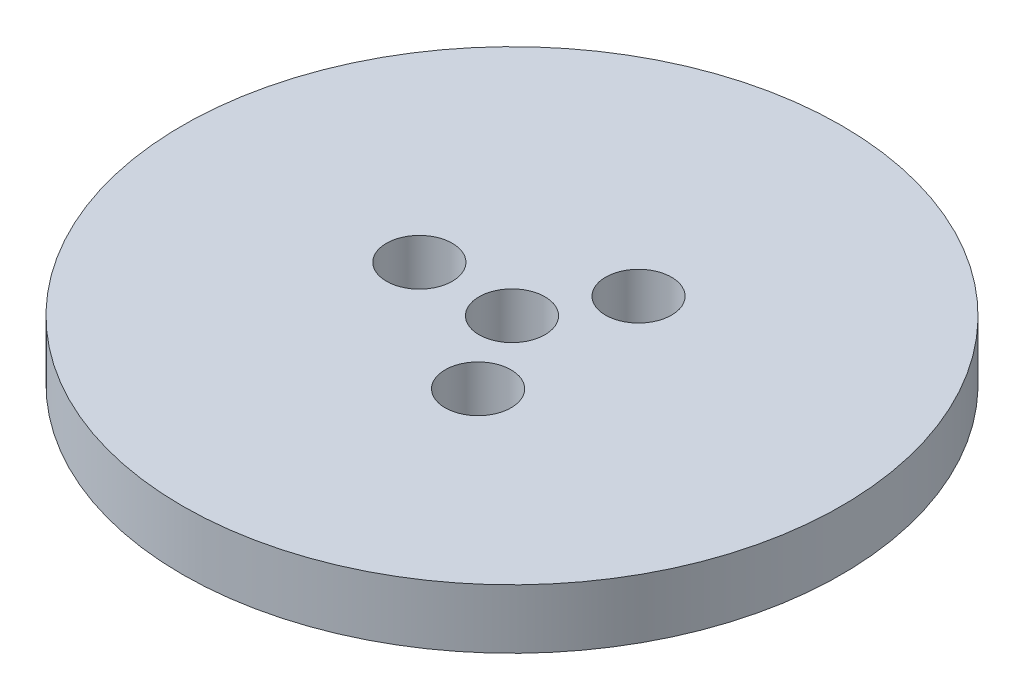
from build123d import *

# Parameters (mm, degrees)
SKETCH1_R           = 100
BOSS_EXTRUDE1_DEPTH = 18
SKETCH2_R           = 10
CUT_EXTRUDE1_DEPTH  = 143.562267098
SKETCH3_R           = 10
CUT_EXTRUDE2_DEPTH  = 15.080526385
CIRPATTERN1_COUNT   = 3


with BuildPart() as part:
    # Sketch1 → Boss-Extrude1 (new body)
    with BuildSketch(Plane(origin=(0, 0, 0), x_dir=(1, 0, 0), z_dir=(0, 1, 0))):
        Circle(SKETCH1_R)
    extrude(amount=BOSS_EXTRUDE1_DEPTH)

    # Sketch2 → Cut-Extrude1 (cut, through all)
    with BuildSketch(Plane(origin=(0, 0, 0), x_dir=(1, 0, 0), z_dir=(0, 1, 0))):
        Circle(SKETCH2_R)
    extrude(amount=CUT_EXTRUDE1_DEPTH, mode=Mode.SUBTRACT)

    # Sketch3 → Cut-Extrude2 (cut)
    with BuildSketch(Plane(origin=(0, 18, 0), x_dir=(1, 0, 0), z_dir=(0, 1, 0))):
        with Locations((-28.10874471, 0)):
            Circle(SKETCH3_R)
    cut_extrude2 = extrude(amount=-CUT_EXTRUDE2_DEPTH, mode=Mode.SUBTRACT)

    # CirPattern1: Cut-Extrude2 ×3 about axis
    cirpattern1_axis = Axis((0, 0, 0), (0, 1, 0))
    for i in range(1, CIRPATTERN1_COUNT):
        add(cut_extrude2.rotate(cirpattern1_axis, i * 360 / CIRPATTERN1_COUNT), mode=Mode.SUBTRACT)


solid = part.part
